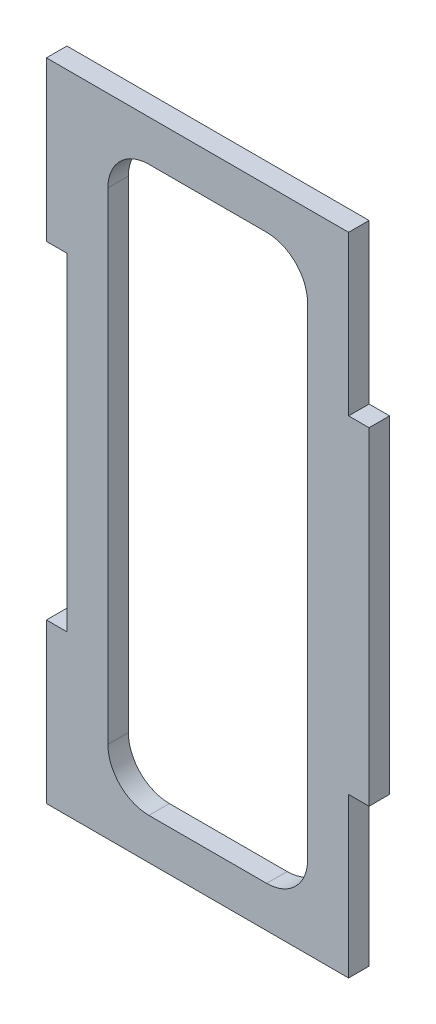
from build123d import *

# Parameters (mm, degrees)
SKETCH1_W           = 100
SKETCH1_H           = 200.1518
BOSS_EXTRUDE1_DEPTH = 6.35
SKETCH2_W           = 6.35
SKETCH2_H           = 101.6
SKETCH2_H_2         = 49.2759
CUT_EXTRUDE1_DEPTH  = 6.35
SKETCH3_W           = 61.9
SKETCH3_H           = 174.7518
CUT_EXTRUDE2_DEPTH  = 6.35
FILLET1_R           = 12.7


with BuildPart() as part:
    # Sketch1 → Boss-Extrude1 (new body)
    with BuildSketch(Plane.XY):
        with Locations((0, -50.0759)):
            Rectangle(SKETCH1_W, SKETCH1_H)
    extrude(amount=BOSS_EXTRUDE1_DEPTH)

    # Sketch2 → Cut-Extrude1 (cut)
    with BuildSketch(Plane.XY.offset(6.35)):
        with Locations((-46.825, -50.0759)):
            Rectangle(SKETCH2_W, SKETCH2_H)
        with Locations((46.825, 25.36205)):
            Rectangle(SKETCH2_W, SKETCH2_H_2)
        with Locations((46.825, -125.51385)):
            Rectangle(SKETCH2_W, SKETCH2_H_2)
    extrude(amount=-CUT_EXTRUDE1_DEPTH, mode=Mode.SUBTRACT)

    # Sketch3 → Cut-Extrude2 (cut)
    with BuildSketch(Plane.XY.offset(6.35)):
        with Locations((0, -50.0759)):
            Rectangle(SKETCH3_W, SKETCH3_H)
    extrude(amount=-CUT_EXTRUDE2_DEPTH, mode=Mode.SUBTRACT)

    # Fillet1
    fillet1_edges = [part.edges().sort_by_distance(p)[0] for p in [
        (30.95, -137.4518, 3.175),
        (30.95, 37.3, 3.175),
        (-30.95, 37.3, 3.175),
        (-30.95, -137.4518, 3.175),
    ]]
    fillet(fillet1_edges, radius=FILLET1_R)


solid = part.part
